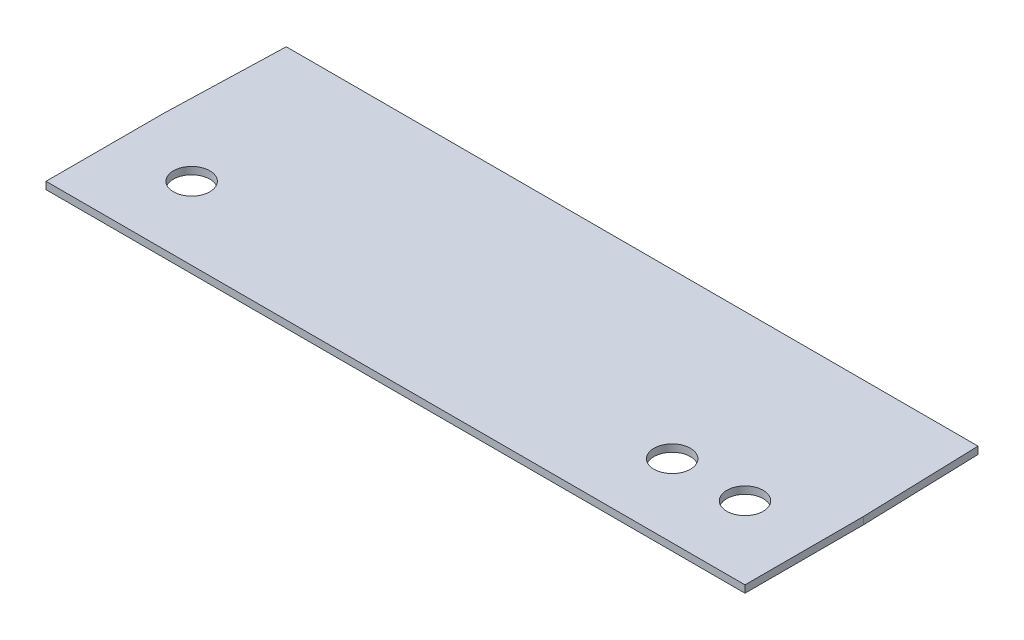
from build123d import *

# Parameters (mm, degrees)
BOSS_EXTRUDE1_DEPTH = 2
SKETCH3_R           = 5
CUT_EXTRUDE2_DEPTH  = 10


with BuildPart() as part:
    # Sketch1 → Boss-Extrude1 (new body)
    with BuildSketch(Plane(origin=(0, 0, 0), x_dir=(1, 0, 0), z_dir=(0, 1, 0))):
        Polygon((-96, 0), (-95, 32.5), (95, 32.5), (96, 0), (96, -32.5), (-96, -32.5), align=None)
    extrude(amount=BOSS_EXTRUDE1_DEPTH)

    # Sketch3 → Cut-Extrude2 (cut)
    with BuildSketch(Plane(origin=(0, 2, 0), x_dir=(1, 0, 0), z_dir=(0, 1, 0))):
        with Locations((-76, -12.5)):
            Circle(SKETCH3_R)
        with Locations((56, -12.5)):
            Circle(SKETCH3_R)
        with Locations((76, -12.5)):
            Circle(SKETCH3_R)
    extrude(amount=-CUT_EXTRUDE2_DEPTH, mode=Mode.SUBTRACT)


solid = part.part
